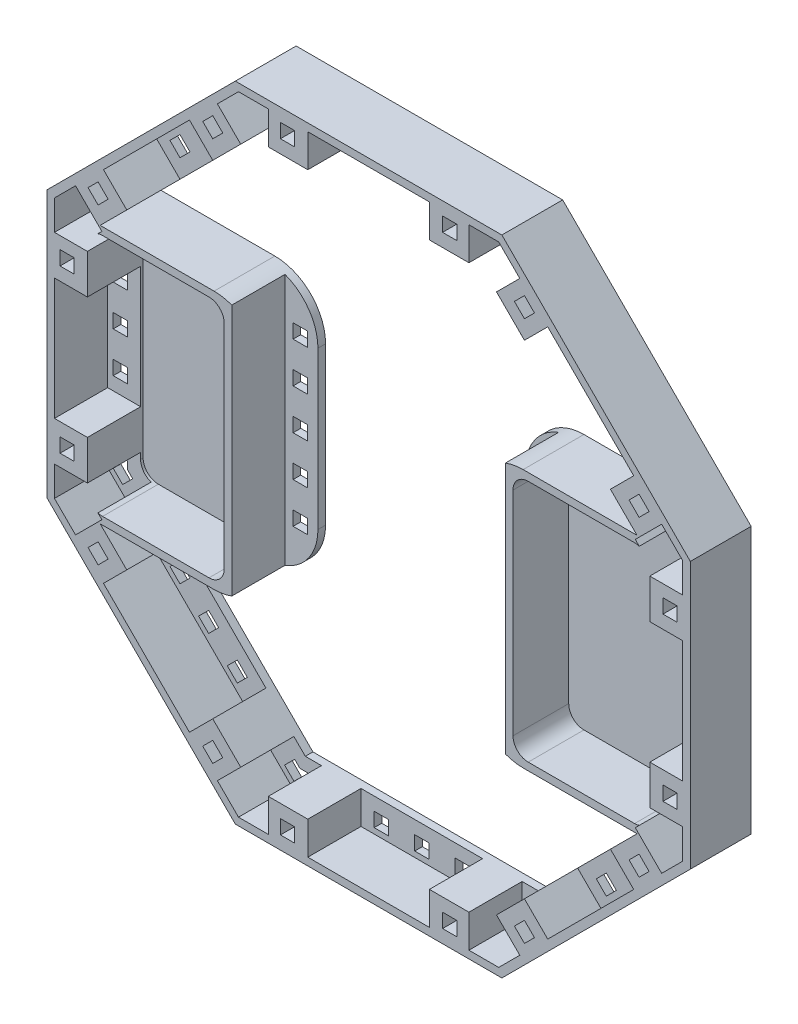
from build123d import *

# Parameters (mm, degrees)
RESSALTO_EXTRUS_O1_DEPTH = 2.5
CORTE_EXTRUS_O1_DEPTH    = 90.837353033
CORTE_EXTRUS_O2_DEPTH    = 10.5
RESSALTO_EXTRUS_O2_DEPTH = 9.5
ESBO_O5_W                = 2.8
ESBO_O5_H                = 2.8
CORTE_EXTRUS_O3_DEPTH    = 91.600772624
ESBO_O8_W                = 2.8
ESBO_O8_H                = 2.8
RESSALTO_EXTRUS_O3_DEPTH = 9.5
ESBO_O9_W                = 2.8
ESBO_O9_H                = 2.8
CORTE_EXTRUS_O4_DEPTH    = 91.303654411
RESSALTO_EXTRUS_O4_DEPTH = 1
ESBO_O12_W               = 24
ESBO_O12_H               = 6.5
ESBO_O12_W_2             = 6.5
ESBO_O12_H_2             = 24
SIMPLIFICACAO_DEPTH      = 10.5


with BuildPart() as part:
    # Esboço1 → Ressalto-extrusão1 (new body)
    with BuildSketch(Plane.XY):
        Polygon((63.5, -26.302561211), (63.5, 26.302561211), (26.302561211, 63.5), (-26.302561211, 63.5), (-63.5, 26.302561211), (-63.5, -26.302561211), (-26.302561211, -63.5), (26.302561211, -63.5), align=None)
    extrude(amount=RESSALTO_EXTRUS_O1_DEPTH)

    # Esboço2 → Corte-extrusão1 (cut, through all)
    with BuildSketch(Plane(origin=(0, 0, 0), x_dir=(-1, 0, 0), z_dir=(0, 0, -1))):
        with BuildLine():
            Line((52.5, 24), (31.5, 24))
            ThreePointArc((31.5, 24), (29.378679656, 23.121320344), (28.5, 21))
            Line((28.5, 21), (28.5, -21))
            ThreePointArc((28.5, -21), (29.378679656, -23.121320344), (31.5, -24))
            Line((31.5, -24), (52.5, -24))
            ThreePointArc((52.5, -24), (54.621320344, -23.121320344), (55.5, -21))
            Line((55.5, -21), (55.5, 21))
            ThreePointArc((55.5, 21), (54.621320344, 23.121320344), (52.5, 24))
        make_face()
        with BuildLine():
            Line((-28.5, 21), (-28.5, -21))
            ThreePointArc((-28.5, -21), (-29.378679656, -23.121320344), (-31.5, -24))
            Line((-31.5, -24), (-52.5, -24))
            ThreePointArc((-52.5, -24), (-54.621320344, -23.121320344), (-55.5, -21))
            Line((-55.5, -21), (-55.5, 21))
            ThreePointArc((-55.5, 21), (-54.621320344, 23.121320344), (-52.5, 24))
            Line((-52.5, 24), (-31.5, 24))
            ThreePointArc((-31.5, 24), (-29.378679656, 23.121320344), (-28.5, 21))
        make_face()
    extrude(amount=-CORTE_EXTRUS_O1_DEPTH, mode=Mode.SUBTRACT)

    # Esboço4 → Corte-extrusão2 (cut)
    with BuildSketch(Plane.XY.offset(2.5)):
        Polygon((-36.062445841, 34.082546853), (-34.082546853, 36.062445841), (-36.062445841, 38.042344828), (-38.042344828, 36.062445841), align=None)
        Polygon((36.062445841, 34.082546853), (38.042344828, 36.062445841), (36.062445841, 38.042344828), (34.082546853, 36.062445841), align=None)
        Polygon((36.062445841, -38.042344828), (38.042344828, -36.062445841), (36.062445841, -34.082546853), (34.082546853, -36.062445841), align=None)
        Polygon((-36.062445841, -38.042344828), (-34.082546853, -36.062445841), (-36.062445841, -34.082546853), (-38.042344828, -36.062445841), align=None)
    extrude(amount=-CORTE_EXTRUS_O2_DEPTH, mode=Mode.SUBTRACT)

    # Esboço7 → Ressalto-extrusão2 (add)
    with BuildSketch(Plane.XY.offset(2.5)):
        Polygon((26.302561211, -63.5), (63.5, -26.302561211), (63.5, 26.302561211), (26.302561211, 63.5), (-26.302561211, 63.5), (-63.5, 26.302561211), (-63.5, -26.302561211), (-26.302561211, -63.5), align=None)
        Polygon((22.988852712, -55.5), (55.5, -22.988852712), (55.5, 22.988852712), (22.988852712, 55.5), (-22.988852712, 55.5), (-55.5, 22.988852712), (-55.5, -22.988852712), (-22.988852712, -55.5), align=None, mode=Mode.SUBTRACT)
    extrude(amount=RESSALTO_EXTRUS_O2_DEPTH)

    # Esboço5 → Corte-extrusão3 (cut, through all)
    with BuildSketch(Plane(origin=(0, 0, 0), x_dir=(-1, 0, 0), z_dir=(0, 0, -1))):
        Polygon((-47.72970773, -34.436100244), (-49.709606717, -36.415999231), (-47.72970773, -38.395898218), (-45.749808743, -36.415999231), align=None)
        Polygon((-42.072853481, -40.092954493), (-44.052752468, -42.072853481), (-42.072853481, -44.052752468), (-40.092954493, -42.072853481), align=None)
        Polygon((-53.38656198, -28.779245994), (-55.366460967, -30.759144982), (-53.38656198, -32.739043969), (-51.406662992, -30.759144982), align=None)
        with Locations((-8, 24)):
            Rectangle(ESBO_O5_W, ESBO_O5_H)
        Polygon((-25.225605949, -60.9), (-27.082189719, -59.043416229), (-25.102290732, -57.063517242), (-24.065807974, -58.1), (-22.6, -58.1), (-22.6, -60.9), align=None)
        Polygon((-30.759144982, -55.366460967), (-32.739043969, -53.38656198), (-30.759144982, -51.406662992), (-28.779245994, -53.38656198), align=None)
        Polygon((-36.415999231, -49.709606717), (-38.395898218, -47.72970773), (-36.415999231, -45.749808743), (-34.436100244, -47.72970773), align=None)
        with Locations((-8, 8)):
            Rectangle(ESBO_O5_W, ESBO_O5_H)
        with Locations((0, -59.5)):
            Rectangle(ESBO_O5_W, ESBO_O5_H)
        with Locations((-16, -59.5)):
            Rectangle(ESBO_O5_W, ESBO_O5_H)
        with Locations((8, 24)):
            Rectangle(ESBO_O5_W, ESBO_O5_H)
        with Locations((-8, 0)):
            Rectangle(ESBO_O5_W, ESBO_O5_H)
        with Locations((8, -24)):
            Rectangle(ESBO_O5_W, ESBO_O5_H)
        with Locations((-8, -24)):
            Rectangle(ESBO_O5_W, ESBO_O5_H)
        with Locations((-8, -8)):
            Rectangle(ESBO_O5_W, ESBO_O5_H)
        Polygon((24.065807974, -58.1), (25.102290732, -57.063517242), (27.082189719, -59.043416229), (25.225605949, -60.9), (22.6, -60.9), (22.6, -58.1), align=None)
        Polygon((60.9, -25.225605949), (59.043416229, -27.082189719), (57.063517242, -25.102290732), (58.1, -24.065807974), (58.1, -22.6), (60.9, -22.6), align=None)
        with Locations((59.5, -8)):
            Rectangle(ESBO_O5_W, ESBO_O5_H)
        with Locations((59.5, 0)):
            Rectangle(ESBO_O5_W, ESBO_O5_H)
        with Locations((16, -59.5)):
            Rectangle(ESBO_O5_W, ESBO_O5_H)
        with Locations((8, -8)):
            Rectangle(ESBO_O5_W, ESBO_O5_H)
        Polygon((34.436100244, -47.72970773), (36.415999231, -49.709606717), (38.395898218, -47.72970773), (36.415999231, -45.749808743), align=None)
        Polygon((40.092954493, -42.072853481), (42.072853481, -44.052752468), (44.052752468, -42.072853481), (42.072853481, -40.092954493), align=None)
        Polygon((28.779245994, -53.38656198), (30.759144982, -55.366460967), (32.739043969, -53.38656198), (30.759144982, -51.406662992), align=None)
        Polygon((55.366460967, -30.759144982), (53.38656198, -32.739043969), (51.406662992, -30.759144982), (53.38656198, -28.779245994), align=None)
        Polygon((49.709606717, -36.415999231), (47.72970773, -38.395898218), (45.749808743, -36.415999231), (47.72970773, -34.436100244), align=None)
        with Locations((59.5, -16)):
            Rectangle(ESBO_O5_W, ESBO_O5_H)
        with Locations((8, 0)):
            Rectangle(ESBO_O5_W, ESBO_O5_H)
        Polygon((58.1, 24.065807974), (57.063517242, 25.102290732), (59.043416229, 27.082189719), (60.9, 25.225605949), (60.9, 22.6), (58.1, 22.6), align=None)
        Polygon((47.72970773, 34.436100244), (49.709606717, 36.415999231), (47.72970773, 38.395898218), (45.749808743, 36.415999231), align=None)
        Polygon((42.072853481, 40.092954493), (44.052752468, 42.072853481), (42.072853481, 44.052752468), (40.092954493, 42.072853481), align=None)
        Polygon((53.38656198, 28.779245994), (55.366460967, 30.759144982), (53.38656198, 32.739043969), (51.406662992, 30.759144982), align=None)
        with Locations((59.5, 16)):
            Rectangle(ESBO_O5_W, ESBO_O5_H)
        Polygon((25.225605949, 60.9), (27.082189719, 59.043416229), (25.102290732, 57.063517242), (24.065807974, 58.1), (22.6, 58.1), (22.6, 60.9), align=None)
        Polygon((30.759144982, 55.366460967), (32.739043969, 53.38656198), (30.759144982, 51.406662992), (28.779245994, 53.38656198), align=None)
        Polygon((36.415999231, 49.709606717), (38.395898218, 47.72970773), (36.415999231, 45.749808743), (34.436100244, 47.72970773), align=None)
        with Locations((8, 8)):
            Rectangle(ESBO_O5_W, ESBO_O5_H)
        with Locations((16, 59.5)):
            Rectangle(ESBO_O5_W, ESBO_O5_H)
        with Locations((59.5, 8)):
            Rectangle(ESBO_O5_W, ESBO_O5_H)
        Polygon((-24.065807974, 58.1), (-25.102290732, 57.063517242), (-27.082189719, 59.043416229), (-25.225605949, 60.9), (-22.6, 60.9), (-22.6, 58.1), align=None)
        with Locations((-16, 59.5)):
            Rectangle(ESBO_O5_W, ESBO_O5_H)
        with Locations((-8, 59.5)):
            Rectangle(ESBO_O5_W, ESBO_O5_H)
        with Locations((0, 59.5)):
            Rectangle(ESBO_O5_W, ESBO_O5_H)
        Polygon((-34.436100244, 47.72970773), (-36.415999231, 49.709606717), (-38.395898218, 47.72970773), (-36.415999231, 45.749808743), align=None)
        Polygon((-40.092954493, 42.072853481), (-42.072853481, 44.052752468), (-44.052752468, 42.072853481), (-42.072853481, 40.092954493), align=None)
        Polygon((-28.779245994, 53.38656198), (-30.759144982, 55.366460967), (-32.739043969, 53.38656198), (-30.759144982, 51.406662992), align=None)
        Polygon((-55.366460967, 30.759144982), (-53.38656198, 32.739043969), (-51.406662992, 30.759144982), (-53.38656198, 28.779245994), align=None)
        Polygon((-49.709606717, 36.415999231), (-47.72970773, 38.395898218), (-45.749808743, 36.415999231), (-47.72970773, 34.436100244), align=None)
        Rectangle(ESBO_O5_W, ESBO_O5_H)
        with Locations((8, 59.5)):
            Rectangle(ESBO_O5_W, ESBO_O5_H)
        with Locations((8, -59.5)):
            Rectangle(ESBO_O5_W, ESBO_O5_H)
        with Locations((24, 0)):
            Rectangle(ESBO_O5_W, ESBO_O5_H)
        with Locations((-8, -59.5)):
            Rectangle(ESBO_O5_W, ESBO_O5_H)
        with Locations((8, 16)):
            Rectangle(ESBO_O5_W, ESBO_O5_H)
        with Locations((24, 16)):
            Rectangle(ESBO_O5_W, ESBO_O5_H)
        with Locations((16, 24)):
            Rectangle(ESBO_O5_W, ESBO_O5_H)
        with Locations((8, 32)):
            Rectangle(ESBO_O5_W, ESBO_O5_H)
        with Locations((16, 32)):
            Rectangle(ESBO_O5_W, ESBO_O5_H)
        with Locations((24, 32)):
            Rectangle(ESBO_O5_W, ESBO_O5_H)
        with Locations((32, 32)):
            Rectangle(ESBO_O5_W, ESBO_O5_H)
        with Locations((40, 32)):
            Rectangle(ESBO_O5_W, ESBO_O5_H)
        with Locations((8, 40)):
            Rectangle(ESBO_O5_W, ESBO_O5_H)
        with Locations((16, 40)):
            Rectangle(ESBO_O5_W, ESBO_O5_H)
        with Locations((24, 40)):
            Rectangle(ESBO_O5_W, ESBO_O5_H)
        with Locations((32, 40)):
            Rectangle(ESBO_O5_W, ESBO_O5_H)
        with Locations((8, 48)):
            Rectangle(ESBO_O5_W, ESBO_O5_H)
        with Locations((16, 48)):
            Rectangle(ESBO_O5_W, ESBO_O5_H)
        with Locations((24, 48)):
            Rectangle(ESBO_O5_W, ESBO_O5_H)
        with Locations((0, 8)):
            Rectangle(ESBO_O5_W, ESBO_O5_H)
        with Locations((0, 16)):
            Rectangle(ESBO_O5_W, ESBO_O5_H)
        with Locations((0, 24)):
            Rectangle(ESBO_O5_W, ESBO_O5_H)
        with Locations((0, 32)):
            Rectangle(ESBO_O5_W, ESBO_O5_H)
        with Locations((0, 40)):
            Rectangle(ESBO_O5_W, ESBO_O5_H)
        with Locations((0, 48)):
            Rectangle(ESBO_O5_W, ESBO_O5_H)
        with Locations((-24, 48)):
            Rectangle(ESBO_O5_W, ESBO_O5_H)
        with Locations((-16, 48)):
            Rectangle(ESBO_O5_W, ESBO_O5_H)
        with Locations((-8, 48)):
            Rectangle(ESBO_O5_W, ESBO_O5_H)
        with Locations((-32, 40)):
            Rectangle(ESBO_O5_W, ESBO_O5_H)
        with Locations((-24, 40)):
            Rectangle(ESBO_O5_W, ESBO_O5_H)
        with Locations((-16, 40)):
            Rectangle(ESBO_O5_W, ESBO_O5_H)
        with Locations((-8, 40)):
            Rectangle(ESBO_O5_W, ESBO_O5_H)
        with Locations((-40, 32)):
            Rectangle(ESBO_O5_W, ESBO_O5_H)
        with Locations((-32, 32)):
            Rectangle(ESBO_O5_W, ESBO_O5_H)
        with Locations((-24, 32)):
            Rectangle(ESBO_O5_W, ESBO_O5_H)
        with Locations((-16, 32)):
            Rectangle(ESBO_O5_W, ESBO_O5_H)
        with Locations((-8, 32)):
            Rectangle(ESBO_O5_W, ESBO_O5_H)
        with Locations((-16, 24)):
            Rectangle(ESBO_O5_W, ESBO_O5_H)
        with Locations((-24, 16)):
            Rectangle(ESBO_O5_W, ESBO_O5_H)
        with Locations((-8, 16)):
            Rectangle(ESBO_O5_W, ESBO_O5_H)
        with Locations((-24, 0)):
            Rectangle(ESBO_O5_W, ESBO_O5_H)
        with Locations((40, -32)):
            Rectangle(ESBO_O5_W, ESBO_O5_H)
        with Locations((-40, -32)):
            Rectangle(ESBO_O5_W, ESBO_O5_H)
        with Locations((-8, -16)):
            Rectangle(ESBO_O5_W, ESBO_O5_H)
        with Locations((-24, -16)):
            Rectangle(ESBO_O5_W, ESBO_O5_H)
        with Locations((-16, -24)):
            Rectangle(ESBO_O5_W, ESBO_O5_H)
        with Locations((-8, -32)):
            Rectangle(ESBO_O5_W, ESBO_O5_H)
        with Locations((-16, -32)):
            Rectangle(ESBO_O5_W, ESBO_O5_H)
        with Locations((-24, -32)):
            Rectangle(ESBO_O5_W, ESBO_O5_H)
        with Locations((-32, -32)):
            Rectangle(ESBO_O5_W, ESBO_O5_H)
        with Locations((-8, -40)):
            Rectangle(ESBO_O5_W, ESBO_O5_H)
        with Locations((-16, -40)):
            Rectangle(ESBO_O5_W, ESBO_O5_H)
        with Locations((-24, -40)):
            Rectangle(ESBO_O5_W, ESBO_O5_H)
        with Locations((-32, -40)):
            Rectangle(ESBO_O5_W, ESBO_O5_H)
        with Locations((-8, -48)):
            Rectangle(ESBO_O5_W, ESBO_O5_H)
        with Locations((-16, -48)):
            Rectangle(ESBO_O5_W, ESBO_O5_H)
        with Locations((-24, -48)):
            Rectangle(ESBO_O5_W, ESBO_O5_H)
        with Locations((0, -48)):
            Rectangle(ESBO_O5_W, ESBO_O5_H)
        with Locations((0, -40)):
            Rectangle(ESBO_O5_W, ESBO_O5_H)
        with Locations((0, -32)):
            Rectangle(ESBO_O5_W, ESBO_O5_H)
        with Locations((0, -24)):
            Rectangle(ESBO_O5_W, ESBO_O5_H)
        with Locations((0, -16)):
            Rectangle(ESBO_O5_W, ESBO_O5_H)
        with Locations((0, -8)):
            Rectangle(ESBO_O5_W, ESBO_O5_H)
        with Locations((24, -48)):
            Rectangle(ESBO_O5_W, ESBO_O5_H)
        with Locations((16, -48)):
            Rectangle(ESBO_O5_W, ESBO_O5_H)
        with Locations((8, -48)):
            Rectangle(ESBO_O5_W, ESBO_O5_H)
        with Locations((32, -40)):
            Rectangle(ESBO_O5_W, ESBO_O5_H)
        with Locations((24, -40)):
            Rectangle(ESBO_O5_W, ESBO_O5_H)
        with Locations((16, -40)):
            Rectangle(ESBO_O5_W, ESBO_O5_H)
        with Locations((8, -40)):
            Rectangle(ESBO_O5_W, ESBO_O5_H)
        with Locations((32, -32)):
            Rectangle(ESBO_O5_W, ESBO_O5_H)
        with Locations((24, -32)):
            Rectangle(ESBO_O5_W, ESBO_O5_H)
        with Locations((16, -32)):
            Rectangle(ESBO_O5_W, ESBO_O5_H)
        with Locations((8, -32)):
            Rectangle(ESBO_O5_W, ESBO_O5_H)
        with Locations((16, -24)):
            Rectangle(ESBO_O5_W, ESBO_O5_H)
        with Locations((24, -16)):
            Rectangle(ESBO_O5_W, ESBO_O5_H)
        with Locations((8, -16)):
            Rectangle(ESBO_O5_W, ESBO_O5_H)
        Polygon((-60.9, 25.225605949), (-59.043416229, 27.082189719), (-57.063517242, 25.102290732), (-58.1, 24.065807974), (-58.1, 22.6), (-60.9, 22.6), align=None)
        with Locations((-59.5, 8)):
            Rectangle(ESBO_O5_W, ESBO_O5_H)
        with Locations((-59.5, 16)):
            Rectangle(ESBO_O5_W, ESBO_O5_H)
        Polygon((-58.1, -24.065807974), (-57.063517242, -25.102290732), (-59.043416229, -27.082189719), (-60.9, -25.225605949), (-60.9, -22.6), (-58.1, -22.6), align=None)
        with Locations((-59.5, -16)):
            Rectangle(ESBO_O5_W, ESBO_O5_H)
        with Locations((-59.5, -8)):
            Rectangle(ESBO_O5_W, ESBO_O5_H)
        with Locations((-59.5, 0)):
            Rectangle(ESBO_O5_W, ESBO_O5_H)
    extrude(amount=-CORTE_EXTRUS_O3_DEPTH, mode=Mode.SUBTRACT)

    # Esboço8 → Ressalto-extrusão3 (add)
    # profile 1 of 2: a face of its own
    with BuildSketch(Plane.XY.offset(2.5)):
        with BuildLine():
            ThreePointArc((-20.5, -15.5), (-23.428932188, -22.571067812), (-30.5, -25.5))
            Line((-30.5, -25.5), (-42, -25.5))
            Line((-42, -25.5), (-52.988852712, -25.5))
            Line((-52.988852712, -25.5), (-55.5, -22.988852712))
            Line((-55.5, -22.988852712), (-55.5, -21))
            ThreePointArc((-55.5, -21), (-54.621320344, -23.121320344), (-52.5, -24))
            Line((-52.5, -24), (-31.5, -24))
            ThreePointArc((-31.5, -24), (-29.378679656, -23.121320344), (-28.5, -21))
            Line((-28.5, -21), (-28.5, 21))
            ThreePointArc((-28.5, 21), (-29.378679656, 23.121320344), (-31.5, 24))
            Line((-31.5, 24), (-52.5, 24))
            ThreePointArc((-52.5, 24), (-54.621320344, 23.121320344), (-55.5, 21))
            Line((-55.5, 21), (-55.5, 22.988852712))
            Line((-55.5, 22.988852712), (-52.988852712, 25.5))
            Line((-52.988852712, 25.5), (-42, 25.5))
            Line((-42, 25.5), (-30.5, 25.5))
            ThreePointArc((-30.5, 25.5), (-23.428932188, 22.571067812), (-20.5, 15.5))
            Line((-20.5, 15.5), (-20.5, 0))
            Line((-20.5, 0), (-20.5, -15.5))
        make_face()
        with Locations((-24, 16)):
            Rectangle(ESBO_O8_W, ESBO_O8_H, mode=Mode.SUBTRACT)
        with Locations((-24, 8)):
            Rectangle(ESBO_O8_W, ESBO_O8_H, mode=Mode.SUBTRACT)
        with Locations((-24, 0)):
            Rectangle(ESBO_O8_W, ESBO_O8_H, mode=Mode.SUBTRACT)
        with Locations((-24, -8)):
            Rectangle(ESBO_O8_W, ESBO_O8_H, mode=Mode.SUBTRACT)
        with Locations((-24, -16)):
            Rectangle(ESBO_O8_W, ESBO_O8_H, mode=Mode.SUBTRACT)
    # profile 2 of 2: a face of its own
    with BuildSketch(Plane.XY.offset(2.5)):
        with BuildLine():
            Line((28.5, 21), (28.5, -21))
            ThreePointArc((28.5, -21), (29.378679656, -23.121320344), (31.5, -24))
            Line((31.5, -24), (52.5, -24))
            ThreePointArc((52.5, -24), (54.621320344, -23.121320344), (55.5, -21))
            Line((55.5, -21), (55.5, -22.988852712))
            Line((55.5, -22.988852712), (52.988852712, -25.5))
            Line((52.988852712, -25.5), (42, -25.5))
            Line((42, -25.5), (30.5, -25.5))
            ThreePointArc((30.5, -25.5), (23.428932188, -22.571067812), (20.5, -15.5))
            Line((20.5, -15.5), (20.5, 0))
            Line((20.5, 0), (20.5, 15.5))
            ThreePointArc((20.5, 15.5), (23.428932188, 22.571067812), (30.5, 25.5))
            Line((30.5, 25.5), (42, 25.5))
            Line((42, 25.5), (52.988852712, 25.5))
            Line((52.988852712, 25.5), (55.5, 22.988852712))
            Line((55.5, 22.988852712), (55.5, 21))
            ThreePointArc((55.5, 21), (54.621320344, 23.121320344), (52.5, 24))
            Line((52.5, 24), (31.5, 24))
            ThreePointArc((31.5, 24), (29.378679656, 23.121320344), (28.5, 21))
        make_face()
        with Locations((24, 8)):
            Rectangle(ESBO_O8_W, ESBO_O8_H, mode=Mode.SUBTRACT)
        with Locations((24, -8)):
            Rectangle(ESBO_O8_W, ESBO_O8_H, mode=Mode.SUBTRACT)
        with Locations((24, -16)):
            Rectangle(ESBO_O8_W, ESBO_O8_H, mode=Mode.SUBTRACT)
        with Locations((24, 0)):
            Rectangle(ESBO_O8_W, ESBO_O8_H, mode=Mode.SUBTRACT)
        with Locations((24, 16)):
            Rectangle(ESBO_O8_W, ESBO_O8_H, mode=Mode.SUBTRACT)
    extrude(amount=RESSALTO_EXTRUS_O3_DEPTH)

    # Esboço9 → Corte-extrusão4 (cut, through all)
    with BuildSketch(Plane.XY.offset(2.5)):
        with Locations((-24, 8)):
            Rectangle(ESBO_O9_W, ESBO_O9_H)
        with Locations((-24, -8)):
            Rectangle(ESBO_O9_W, ESBO_O9_H)
        with Locations((24, 8)):
            Rectangle(ESBO_O9_W, ESBO_O9_H)
        with Locations((24, -8)):
            Rectangle(ESBO_O9_W, ESBO_O9_H)
        with BuildLine():
            Line((30.5, 25.5), (52.988852712, 25.5))
            Line((52.988852712, 25.5), (22.988852712, 55.5))
            Line((22.988852712, 55.5), (-22.988852712, 55.5))
            Line((-22.988852712, 55.5), (-52.988852712, 25.5))
            Line((-52.988852712, 25.5), (-30.5, 25.5))
            ThreePointArc((-30.5, 25.5), (-23.428932188, 22.571067812), (-20.5, 15.5))
            Line((-20.5, 15.5), (-20.5, -15.5))
            ThreePointArc((-20.5, -15.5), (-23.428932188, -22.571067812), (-30.5, -25.5))
            Line((-30.5, -25.5), (-52.988852712, -25.5))
            Line((-52.988852712, -25.5), (-22.988852712, -55.5))
            Line((-22.988852712, -55.5), (22.988852712, -55.5))
            Line((22.988852712, -55.5), (52.988852712, -25.5))
            Line((52.988852712, -25.5), (30.5, -25.5))
            ThreePointArc((30.5, -25.5), (23.428932188, -22.571067812), (20.5, -15.5))
            Line((20.5, -15.5), (20.5, 15.5))
            ThreePointArc((20.5, 15.5), (23.428932188, 22.571067812), (30.5, 25.5))
        make_face()
    extrude(amount=-CORTE_EXTRUS_O4_DEPTH, mode=Mode.SUBTRACT)

    # Esboço11 → Ressalto-extrusão4 (add)
    with BuildSketch(Plane(origin=(0, 0, 0), x_dir=(-1, 0, 0), z_dir=(0, 0, -1))):
        with BuildLine():
            Line((-55.5, 21), (-55.5, -21))
            ThreePointArc((-55.5, -21), (-54.621320344, -23.121320344), (-52.5, -24))
            Line((-52.5, -24), (-31.5, -24))
            ThreePointArc((-31.5, -24), (-29.378679656, -23.121320344), (-28.5, -21))
            Line((-28.5, -21), (-28.5, 21))
            ThreePointArc((-28.5, 21), (-29.378679656, 23.121320344), (-31.5, 24))
            Line((-31.5, 24), (-52.5, 24))
            ThreePointArc((-52.5, 24), (-54.621320344, 23.121320344), (-55.5, 21))
        make_face()
        with BuildLine():
            Line((31.5, 24), (52.5, 24))
            ThreePointArc((52.5, 24), (54.621320344, 23.121320344), (55.5, 21))
            Line((55.5, 21), (55.5, -21))
            ThreePointArc((55.5, -21), (54.621320344, -23.121320344), (52.5, -24))
            Line((52.5, -24), (31.5, -24))
            ThreePointArc((31.5, -24), (29.378679656, -23.121320344), (28.5, -21))
            Line((28.5, -21), (28.5, 21))
            ThreePointArc((28.5, 21), (29.378679656, 23.121320344), (31.5, 24))
        make_face()
    extrude(amount=-RESSALTO_EXTRUS_O4_DEPTH)

    # Esboço12 → simplificacao (cut)
    with BuildSketch(Plane.XY.offset(12)):
        Polygon((-27, 0), (-27, 28.348545586), (-27, 31.246503406), (-16.779319246, 31.246503406), (-16.779319246, -30.297921209), (-27, -30.297921209), align=None)
        Polygon((-47.72970773, 30.759144982), (-52.325901808, 35.355339059), (-35.355339059, 52.325901808), (-30.759144982, 47.72970773), align=None)
        with Locations((0, 58.75)):
            Rectangle(ESBO_O12_W, ESBO_O12_H)
        Polygon((30.759144982, 47.72970773), (35.355339059, 52.325901808), (52.325901808, 35.355339059), (47.72970773, 30.759144982), align=None)
        with Locations((58.75, 0)):
            Rectangle(ESBO_O12_W_2, ESBO_O12_H_2)
        Polygon((47.72970773, -30.759144982), (52.325901808, -35.355339059), (35.355339059, -52.325901808), (30.759144982, -47.72970773), align=None)
        with Locations((0, -58.75)):
            Rectangle(ESBO_O12_W, ESBO_O12_H)
        Polygon((-30.759144982, -47.72970773), (-35.355339059, -52.325901808), (-52.325901808, -35.355339059), (-47.72970773, -30.759144982), align=None)
        with Locations((-58.75, 0)):
            Rectangle(ESBO_O12_W_2, ESBO_O12_H_2)
        Polygon((-19.800146811, 62), (-25.681240867, 62), (-29.839802355, 57.841438512), (-24.637745059, 52.639381216), (-22.633946255, 54.643180019), (-19.800146811, 54.643180019), align=None)
        Polygon((27, -30.297921209), (16.779319246, -30.297921209), (16.779319246, 31.246503406), (27, 31.246503406), (27, 28.348545586), (27, 0), align=None)
        Polygon((29.839802355, 57.841438512), (25.681240867, 62), (19.800146811, 62), (19.800146811, 54.643180019), (22.633946255, 54.643180019), (24.637745059, 52.639381216), align=None)
        Polygon((62, 19.800146811), (62, 25.681240867), (57.841438512, 29.839802355), (52.639381216, 24.637745059), (54.643180019, 22.633946255), (54.643180019, 19.800146811), align=None)
        Polygon((57.841438512, -29.839802355), (62, -25.681240867), (62, -19.800146811), (54.643180019, -19.800146811), (54.643180019, -22.633946255), (52.639381216, -24.637745059), align=None)
        Polygon((19.800146811, -62), (25.681240867, -62), (29.839802355, -57.841438512), (24.637745059, -52.639381216), (22.633946255, -54.643180019), (19.800146811, -54.643180019), align=None)
        Polygon((-29.839802355, -57.841438512), (-25.681240867, -62), (-19.800146811, -62), (-19.800146811, -54.643180019), (-22.633946255, -54.643180019), (-24.637745059, -52.639381216), align=None)
        Polygon((-62, -19.800146811), (-62, -25.681240867), (-57.841438512, -29.839802355), (-52.639381216, -24.637745059), (-54.643180019, -22.633946255), (-54.643180019, -19.800146811), align=None)
        Polygon((-57.841438512, 29.839802355), (-62, 25.681240867), (-62, 19.800146811), (-54.643180019, 19.800146811), (-54.643180019, 22.633946255), (-52.639381216, 24.637745059), align=None)
    extrude(amount=-SIMPLIFICACAO_DEPTH, mode=Mode.SUBTRACT)


solid = part.part
